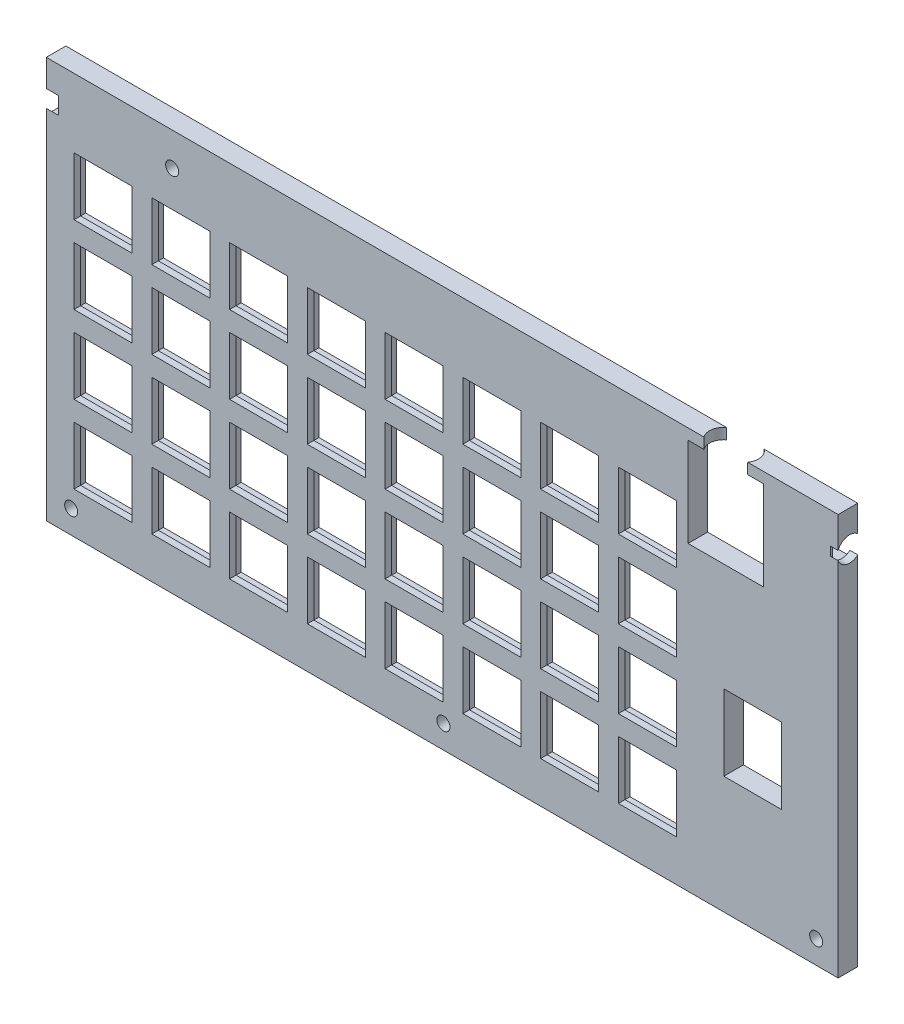
from build123d import *

# Parameters (mm, degrees)
SKETCH1_R           = 1.6
SKETCH1_W           = 18.1
SKETCH1_H           = 18.1
SKETCH1_W_2         = 14.17
SKETCH1_H_2         = 18.54
SKETCH1_W_3         = 1.2
SKETCH1_H_3         = 2
SKETCH1_W_4         = 12.7
SKETCH1_H_4         = 2.54
BOSS_EXTRUDE1_DEPTH = 3.2
BOSS_EXTRUDE2_START = 3.2
SKETCH1_5_R         = 1.6
SKETCH1_5_W         = 14.17
SKETCH1_5_H         = 18.54
SKETCH1_5_W_2       = 1.2
SKETCH1_5_H_2       = 2
SKETCH1_5_W_3       = 12.7
SKETCH1_5_H_3       = 2.54
SKETCH1_5_W_4       = 14.2
SKETCH1_5_H_4       = 14.2
BOSS_EXTRUDE2_DEPTH = 1.6
BOSS_EXTRUDE3_START = 4.8
SKETCH1_6_W         = 1.2
SKETCH1_6_H         = 2
SKETCH1_6_W_2       = 12.7
SKETCH1_6_H_2       = 2.54
BOSS_EXTRUDE3_DEPTH = 3.65
BOSS_EXTRUDE4_START = 4.8
BOSS_EXTRUDE4_DEPTH = 0.6
CUT_EXTRUDE1_DEPTH  = 1.925
CUT_EXTRUDE2_START  = -2.957
CUT_EXTRUDE2_DEPTH  = 2.957
BOSS_EXTRUDE5_DEPTH = 2.62431
BOSS_EXTRUDE6_DEPTH = 1.925
BOSS_EXTRUDE7_START = -2.957
BOSS_EXTRUDE7_DEPTH = 2.957


with BuildPart() as part:
    # Sketch1 → Boss-Extrude1 (new body)
    with BuildSketch(Plane.XY):
        Polygon((201.81089, -92.0718), (44.6073, -92.0718), (44.6073, -97.3368), (53.3943, -97.3368), (53.3943, -96.9368), (55.7943, -96.9368), (55.7943, -97.3368), (59.7643, -97.3368), (59.7643, -104.2368), (56.7943, -104.2368), (56.7943, -104.6368), (54.3943, -104.6368), (54.3943, -104.2368), (44.6073, -104.2368), (44.6073, -190.4008), (238.5833, -190.4008), (238.5833, -104.2368), (230.8283, -104.2368), (230.8283, -104.6368), (228.4283, -104.6368), (228.4283, -104.2368), (224.4583, -104.2368), (224.4583, -97.3368), (227.4283, -97.3368), (227.4283, -96.9368), (229.8283, -96.9368), (229.8283, -97.3368), (238.5833, -97.3368), (238.5833, -92.0718), (220.31089, -92.0718), (220.31089, -116.59611), (201.81089, -116.59611), align=None)
        with Locations((50.7063, -184.7338)):
            Circle(SKETCH1_R, mode=Mode.SUBTRACT)
        with Locations((58.5043, -173.1768)):
            Rectangle(SKETCH1_W, SKETCH1_H, mode=Mode.SUBTRACT)
        with Locations((77.5543, -173.1768)):
            Rectangle(SKETCH1_W, SKETCH1_H, mode=Mode.SUBTRACT)
        with Locations((96.6043, -173.1768)):
            Rectangle(SKETCH1_W, SKETCH1_H, mode=Mode.SUBTRACT)
        with Locations((115.6543, -173.1768)):
            Rectangle(SKETCH1_W, SKETCH1_H, mode=Mode.SUBTRACT)
        with Locations((134.7043, -173.1768)):
            Rectangle(SKETCH1_W, SKETCH1_H, mode=Mode.SUBTRACT)
        with Locations((58.5043, -154.1268)):
            Rectangle(SKETCH1_W, SKETCH1_H, mode=Mode.SUBTRACT)
        with Locations((77.5543, -154.1268)):
            Rectangle(SKETCH1_W, SKETCH1_H, mode=Mode.SUBTRACT)
        with Locations((96.6043, -154.1268)):
            Rectangle(SKETCH1_W, SKETCH1_H, mode=Mode.SUBTRACT)
        with Locations((115.6543, -154.1268)):
            Rectangle(SKETCH1_W, SKETCH1_H, mode=Mode.SUBTRACT)
        with Locations((134.7043, -154.1268)):
            Rectangle(SKETCH1_W, SKETCH1_H, mode=Mode.SUBTRACT)
        with Locations((141.8923, -184.7338)):
            Circle(SKETCH1_R, mode=Mode.SUBTRACT)
        with Locations((153.7543, -173.1768)):
            Rectangle(SKETCH1_W, SKETCH1_H, mode=Mode.SUBTRACT)
        with Locations((172.8043, -173.1768)):
            Rectangle(SKETCH1_W, SKETCH1_H, mode=Mode.SUBTRACT)
        with Locations((233.2053, -184.7338)):
            Circle(SKETCH1_R, mode=Mode.SUBTRACT)
        with Locations((191.8543, -173.1768)):
            Rectangle(SKETCH1_W, SKETCH1_H, mode=Mode.SUBTRACT)
        with Locations((153.7543, -154.1268)):
            Rectangle(SKETCH1_W, SKETCH1_H, mode=Mode.SUBTRACT)
        with Locations((172.8043, -154.1268)):
            Rectangle(SKETCH1_W, SKETCH1_H, mode=Mode.SUBTRACT)
        with Locations((191.8543, -154.1268)):
            Rectangle(SKETCH1_W, SKETCH1_H, mode=Mode.SUBTRACT)
        with Locations((217.6653, -152.3218)):
            Rectangle(SKETCH1_W_2, SKETCH1_H_2, mode=Mode.SUBTRACT)
        with Locations((58.5043, -135.0768)):
            Rectangle(SKETCH1_W, SKETCH1_H, mode=Mode.SUBTRACT)
        with Locations((77.5543, -135.0768)):
            Rectangle(SKETCH1_W, SKETCH1_H, mode=Mode.SUBTRACT)
        with Locations((96.6043, -135.0768)):
            Rectangle(SKETCH1_W, SKETCH1_H, mode=Mode.SUBTRACT)
        with Locations((115.6543, -135.0768)):
            Rectangle(SKETCH1_W, SKETCH1_H, mode=Mode.SUBTRACT)
        with Locations((134.7043, -135.0768)):
            Rectangle(SKETCH1_W, SKETCH1_H, mode=Mode.SUBTRACT)
        with Locations((58.5043, -116.0268)):
            Rectangle(SKETCH1_W, SKETCH1_H, mode=Mode.SUBTRACT)
        with Locations((77.5543, -116.0268)):
            Rectangle(SKETCH1_W, SKETCH1_H, mode=Mode.SUBTRACT)
        with Locations((62.0853, -100.9138)):
            Rectangle(SKETCH1_W_3, SKETCH1_H_3, mode=Mode.SUBTRACT)
        with Locations((75.4383, -100.2028)):
            Circle(SKETCH1_R, mode=Mode.SUBTRACT)
        with Locations((96.6043, -116.0268)):
            Rectangle(SKETCH1_W, SKETCH1_H, mode=Mode.SUBTRACT)
        with Locations((115.6543, -116.0268)):
            Rectangle(SKETCH1_W, SKETCH1_H, mode=Mode.SUBTRACT)
        with Locations((134.7043, -116.0268)):
            Rectangle(SKETCH1_W, SKETCH1_H, mode=Mode.SUBTRACT)
        with Locations((137.1473, -99.8978)):
            Rectangle(SKETCH1_W_4, SKETCH1_H_4, mode=Mode.SUBTRACT)
        with Locations((153.7543, -135.0768)):
            Rectangle(SKETCH1_W, SKETCH1_H, mode=Mode.SUBTRACT)
        with Locations((172.8043, -135.0768)):
            Rectangle(SKETCH1_W, SKETCH1_H, mode=Mode.SUBTRACT)
        with Locations((191.8543, -135.0768)):
            Rectangle(SKETCH1_W, SKETCH1_H, mode=Mode.SUBTRACT)
        with Locations((153.7543, -116.0268)):
            Rectangle(SKETCH1_W, SKETCH1_H, mode=Mode.SUBTRACT)
        with Locations((172.8043, -116.0268)):
            Rectangle(SKETCH1_W, SKETCH1_H, mode=Mode.SUBTRACT)
        with Locations((191.8543, -116.0268)):
            Rectangle(SKETCH1_W, SKETCH1_H, mode=Mode.SUBTRACT)
        with Locations((221.9783, -106.5018)):
            Rectangle(SKETCH1_W_3, SKETCH1_H_3, mode=Mode.SUBTRACT)
    extrude(amount=BOSS_EXTRUDE1_DEPTH)

    # Sketch1<5> → Boss-Extrude2 (add)
    with BuildSketch(Plane.XY.offset(BOSS_EXTRUDE2_START)):
        Polygon((201.81089, -92.0718), (44.6073, -92.0718), (44.6073, -97.3368), (53.3943, -97.3368), (53.3943, -96.9368), (55.7943, -96.9368), (55.7943, -97.3368), (59.7643, -97.3368), (59.7643, -104.2368), (56.7943, -104.2368), (56.7943, -104.6368), (54.3943, -104.6368), (54.3943, -104.2368), (44.6073, -104.2368), (44.6073, -190.4008), (238.5833, -190.4008), (238.5833, -104.2368), (230.8283, -104.2368), (230.8283, -104.6368), (228.4283, -104.6368), (228.4283, -104.2368), (224.4583, -104.2368), (224.4583, -97.3368), (227.4283, -97.3368), (227.4283, -96.9368), (229.8283, -96.9368), (229.8283, -97.3368), (238.5833, -97.3368), (238.5833, -92.0718), (220.31089, -92.0718), (220.31089, -116.59611), (201.81089, -116.59611), align=None)
        with Locations((50.7063, -184.7338)):
            Circle(SKETCH1_5_R, mode=Mode.SUBTRACT)
        with Locations((141.8923, -184.7338)):
            Circle(SKETCH1_5_R, mode=Mode.SUBTRACT)
        with Locations((233.2053, -184.7338)):
            Circle(SKETCH1_5_R, mode=Mode.SUBTRACT)
        with Locations((217.6653, -152.3218)):
            Rectangle(SKETCH1_5_W, SKETCH1_5_H, mode=Mode.SUBTRACT)
        with Locations((62.0853, -100.9138)):
            Rectangle(SKETCH1_5_W_2, SKETCH1_5_H_2, mode=Mode.SUBTRACT)
        with Locations((75.4383, -100.2028)):
            Circle(SKETCH1_5_R, mode=Mode.SUBTRACT)
        with Locations((137.1473, -99.8978)):
            Rectangle(SKETCH1_5_W_3, SKETCH1_5_H_3, mode=Mode.SUBTRACT)
        with Locations((221.9783, -106.5018)):
            Rectangle(SKETCH1_5_W_2, SKETCH1_5_H_2, mode=Mode.SUBTRACT)
        with Locations((77.5543, -116.0268)):
            Rectangle(SKETCH1_5_W_4, SKETCH1_5_H_4, mode=Mode.SUBTRACT)
        with Locations((58.5043, -116.0268)):
            Rectangle(SKETCH1_5_W_4, SKETCH1_5_H_4, mode=Mode.SUBTRACT)
        with Locations((96.6043, -116.0268)):
            Rectangle(SKETCH1_5_W_4, SKETCH1_5_H_4, mode=Mode.SUBTRACT)
        with Locations((115.6543, -116.0268)):
            Rectangle(SKETCH1_5_W_4, SKETCH1_5_H_4, mode=Mode.SUBTRACT)
        with Locations((134.7043, -116.0268)):
            Rectangle(SKETCH1_5_W_4, SKETCH1_5_H_4, mode=Mode.SUBTRACT)
        with Locations((153.7543, -116.0268)):
            Rectangle(SKETCH1_5_W_4, SKETCH1_5_H_4, mode=Mode.SUBTRACT)
        with Locations((172.8043, -116.0268)):
            Rectangle(SKETCH1_5_W_4, SKETCH1_5_H_4, mode=Mode.SUBTRACT)
        with Locations((191.8543, -116.0268)):
            Rectangle(SKETCH1_5_W_4, SKETCH1_5_H_4, mode=Mode.SUBTRACT)
        with Locations((77.5543, -135.0768)):
            Rectangle(SKETCH1_5_W_4, SKETCH1_5_H_4, mode=Mode.SUBTRACT)
        with Locations((96.6043, -135.0768)):
            Rectangle(SKETCH1_5_W_4, SKETCH1_5_H_4, mode=Mode.SUBTRACT)
        with Locations((115.6543, -135.0768)):
            Rectangle(SKETCH1_5_W_4, SKETCH1_5_H_4, mode=Mode.SUBTRACT)
        with Locations((134.7043, -135.0768)):
            Rectangle(SKETCH1_5_W_4, SKETCH1_5_H_4, mode=Mode.SUBTRACT)
        with Locations((153.7543, -135.0768)):
            Rectangle(SKETCH1_5_W_4, SKETCH1_5_H_4, mode=Mode.SUBTRACT)
        with Locations((172.8043, -135.0768)):
            Rectangle(SKETCH1_5_W_4, SKETCH1_5_H_4, mode=Mode.SUBTRACT)
        with Locations((191.8543, -135.0768)):
            Rectangle(SKETCH1_5_W_4, SKETCH1_5_H_4, mode=Mode.SUBTRACT)
        with Locations((77.5543, -154.1268)):
            Rectangle(SKETCH1_5_W_4, SKETCH1_5_H_4, mode=Mode.SUBTRACT)
        with Locations((96.6043, -154.1268)):
            Rectangle(SKETCH1_5_W_4, SKETCH1_5_H_4, mode=Mode.SUBTRACT)
        with Locations((115.6543, -154.1268)):
            Rectangle(SKETCH1_5_W_4, SKETCH1_5_H_4, mode=Mode.SUBTRACT)
        with Locations((134.7043, -154.1268)):
            Rectangle(SKETCH1_5_W_4, SKETCH1_5_H_4, mode=Mode.SUBTRACT)
        with Locations((153.7543, -154.1268)):
            Rectangle(SKETCH1_5_W_4, SKETCH1_5_H_4, mode=Mode.SUBTRACT)
        with Locations((172.8043, -154.1268)):
            Rectangle(SKETCH1_5_W_4, SKETCH1_5_H_4, mode=Mode.SUBTRACT)
        with Locations((191.8543, -154.1268)):
            Rectangle(SKETCH1_5_W_4, SKETCH1_5_H_4, mode=Mode.SUBTRACT)
        with Locations((77.5543, -173.1768)):
            Rectangle(SKETCH1_5_W_4, SKETCH1_5_H_4, mode=Mode.SUBTRACT)
        with Locations((96.6043, -173.1768)):
            Rectangle(SKETCH1_5_W_4, SKETCH1_5_H_4, mode=Mode.SUBTRACT)
        with Locations((115.6543, -173.1768)):
            Rectangle(SKETCH1_5_W_4, SKETCH1_5_H_4, mode=Mode.SUBTRACT)
        with Locations((134.7043, -173.1768)):
            Rectangle(SKETCH1_5_W_4, SKETCH1_5_H_4, mode=Mode.SUBTRACT)
        with Locations((153.7543, -173.1768)):
            Rectangle(SKETCH1_5_W_4, SKETCH1_5_H_4, mode=Mode.SUBTRACT)
        with Locations((172.8043, -173.1768)):
            Rectangle(SKETCH1_5_W_4, SKETCH1_5_H_4, mode=Mode.SUBTRACT)
        with Locations((191.8543, -173.1768)):
            Rectangle(SKETCH1_5_W_4, SKETCH1_5_H_4, mode=Mode.SUBTRACT)
        with Locations((58.5043, -135.0768)):
            Rectangle(SKETCH1_5_W_4, SKETCH1_5_H_4, mode=Mode.SUBTRACT)
        with Locations((58.5043, -154.1268)):
            Rectangle(SKETCH1_5_W_4, SKETCH1_5_H_4, mode=Mode.SUBTRACT)
        with Locations((58.5043, -173.1768)):
            Rectangle(SKETCH1_5_W_4, SKETCH1_5_H_4, mode=Mode.SUBTRACT)
    extrude(amount=BOSS_EXTRUDE2_DEPTH)

    # Sketch1<6> → Boss-Extrude3 (add)
    with BuildSketch(Plane.XY.offset(BOSS_EXTRUDE3_START)):
        with Locations((221.9783, -106.5018)):
            Rectangle(SKETCH1_6_W, SKETCH1_6_H)
        with Locations((62.0853, -100.9138)):
            Rectangle(SKETCH1_6_W, SKETCH1_6_H)
        with Locations((137.1473, -99.8978)):
            Rectangle(SKETCH1_6_W_2, SKETCH1_6_H_2)
    extrude(amount=-BOSS_EXTRUDE3_DEPTH)

    # Sketch1<7> → Boss-Extrude4 (add)
    with BuildSketch(Plane.XY.offset(BOSS_EXTRUDE4_START)):
        Polygon((238.5833, -104.2368), (238.5833, -97.3368), (229.8283, -97.3368), (229.8283, -96.9368), (227.4283, -96.9368), (227.4283, -97.3368), (224.4583, -97.3368), (224.4583, -104.2368), (228.4283, -104.2368), (228.4283, -104.6368), (230.8283, -104.6368), (230.8283, -104.2368), align=None)
        Polygon((53.3943, -97.3368), (44.6073, -97.3368), (44.6073, -104.2368), (54.3943, -104.2368), (54.3943, -104.6368), (56.7943, -104.6368), (56.7943, -104.2368), (59.7643, -104.2368), (59.7643, -97.3368), (55.7943, -97.3368), (55.7943, -96.9368), (53.3943, -96.9368), align=None)
    extrude(amount=-BOSS_EXTRUDE4_DEPTH)

    # Sketch4 → Cut-Extrude1 (cut)
    with BuildSketch(Plane(origin=(238.5833, 0, 0), x_dir=(0, 0, -1), z_dir=(1, 0, 0))):
        with BuildLine():
            Line((-4.2, -102.826407805), (-4.2, -98.747192195))
            ThreePointArc((-4.2, -98.747192195), (-4.545906044, -99.199865087), (-4.8, -99.709767039))
            Line((-4.8, -99.709767039), (-4.8, -101.863832961))
            ThreePointArc((-4.8, -101.863832961), (-4.545906044, -102.373734913), (-4.2, -102.826407805))
        make_face()
        with BuildLine():
            ThreePointArc((0, -98.550732023), (-2.140175425, -97.790076648), (-4.2, -98.747192195))
            Line((-4.2, -98.747192195), (-4.2, -102.826407805))
            ThreePointArc((-4.2, -102.826407805), (-2.140175425, -103.783523352), (0, -103.022867977))
            Line((0, -103.022867977), (0, -98.550732023))
        make_face()
        with BuildLine():
            ThreePointArc((1, -100.7868), (0.738612788, -99.562055129), (0, -98.550732023))
            Line((0, -98.550732023), (0, -103.022867977))
            ThreePointArc((0, -103.022867977), (0.738612788, -102.011544871), (1, -100.7868))
        make_face()
    extrude(amount=-CUT_EXTRUDE1_DEPTH, mode=Mode.SUBTRACT)

    # Sketch5 → Cut-Extrude2 (cut)
    with BuildSketch(Plane.ZY.offset(-44.6073).offset(CUT_EXTRUDE2_START)):
        with BuildLine():
            ThreePointArc((5.5, -100.7868), (5.158322339, -99.278489687), (4.2, -98.064668482))
            Line((4.2, -98.064668482), (4.2, -103.508931518))
            ThreePointArc((4.2, -103.508931518), (5.158322339, -102.295110313), (5.5, -100.7868))
        make_face()
    extrude(amount=CUT_EXTRUDE2_DEPTH, mode=Mode.SUBTRACT)

    # Sketch6 → Boss-Extrude5 (add)
    with BuildSketch(Plane(origin=(0, -92.0718, 0), x_dir=(1, 0, 0), z_dir=(0, 1, 0))):
        with BuildLine():
            ThreePointArc((205.688608677, -4.8), (205.105329931, -2.244028229), (206.46089, 0))
            Line((206.46089, 0), (201.81089, 0))
            Line((201.81089, 0), (201.81089, -4.8))
            Line((201.81089, -4.8), (205.688608677, -4.8))
        make_face()
        with BuildLine():
            Line((220.31089, 0), (215.66089, 0))
            ThreePointArc((215.66089, 0), (217.016450069, -2.244028229), (216.433171323, -4.8))
            Line((216.433171323, -4.8), (220.31089, -4.8))
            Line((220.31089, -4.8), (220.31089, 0))
        make_face()
    extrude(amount=-BOSS_EXTRUDE5_DEPTH)

    # Sketch4<3> → Boss-Extrude6 (add)
    with BuildSketch(Plane(origin=(238.5833, 0, 0), x_dir=(0, 0, -1), z_dir=(1, 0, 0))):
        with BuildLine():
            Line((0, -97.3368), (-4.2, -97.3368))
            Line((-4.2, -97.3368), (-4.2, -98.747192195))
            ThreePointArc((-4.2, -98.747192195), (-2.140175425, -97.790076648), (0, -98.550732023))
            Line((0, -98.550732023), (0, -97.3368))
        make_face()
        with BuildLine():
            ThreePointArc((0, -103.022867977), (-2.140175425, -103.783523352), (-4.2, -102.826407805))
            Line((-4.2, -102.826407805), (-4.2, -104.2368))
            Line((-4.2, -104.2368), (0, -104.2368))
            Line((0, -104.2368), (0, -103.022867977))
        make_face()
    extrude(amount=-BOSS_EXTRUDE6_DEPTH)

    # Sketch5<3> → Boss-Extrude7 (add)
    with BuildSketch(Plane.ZY.offset(-44.6073).offset(BOSS_EXTRUDE7_START)):
        with BuildLine():
            Line((4.2, -97.3368), (2.589491306, -97.3368))
            ThreePointArc((2.589491306, -97.3368), (3.441444959, -97.597405633), (4.2, -98.064668482))
            Line((4.2, -98.064668482), (4.2, -97.3368))
        make_face()
    extrude(amount=BOSS_EXTRUDE7_DEPTH)


solid = part.part
